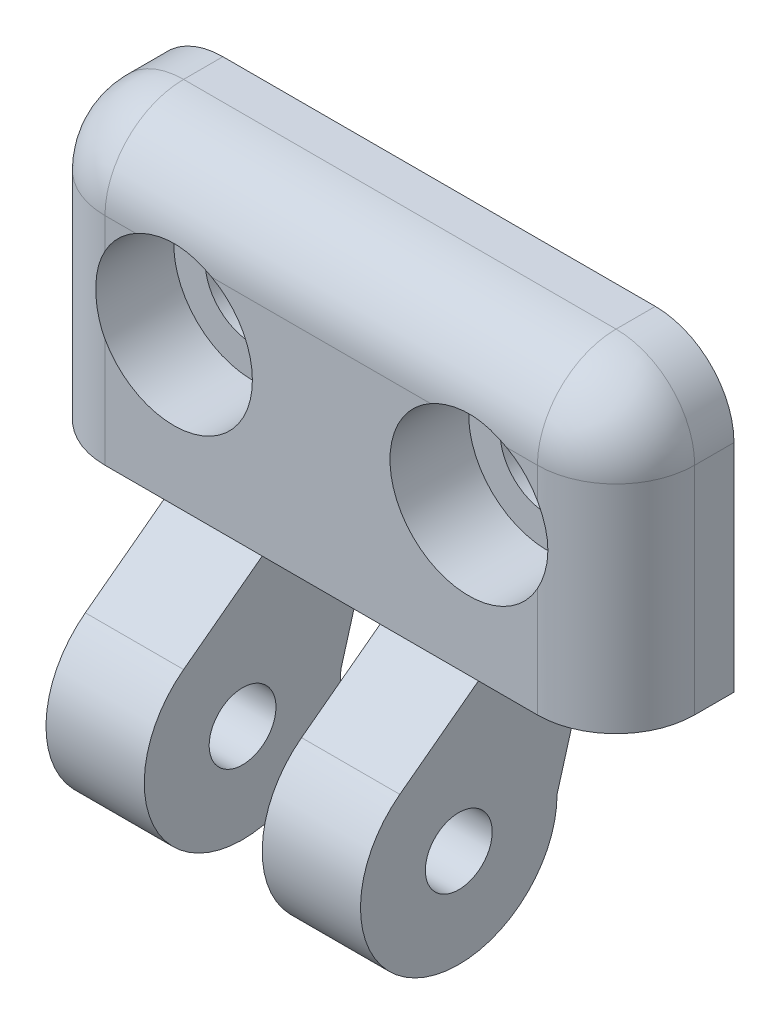
from build123d import *

# Parameters (mm, degrees)
SKETCH2_W                      = 30
SKETCH2_H                      = 15
BOSS_EXTRUDE1_DEPTH            = 6
CBORE_FOR_M4_SHCS1_D           = 4.8
CBORE_FOR_M4_SHCS1_CBORE_D     = 8
CBORE_FOR_M4_SHCS1_CBORE_DEPTH = 4
BOSS_EXTRUDE2_DEPTH            = 30
CUT_EXTRUDE1_START             = -15
SKETCH6_W                      = 6
SKETCH6_H                      = 18.030958188
SKETCH6_W_2                    = 16.282501636
SKETCH6_H_2                    = 17.921679654
SKETCH6_W_3                    = 7
SKETCH6_H_3                    = 20.435085946
CUT_EXTRUDE1_DEPTH             = 28.107006543
CUT_EXTRUDE2_DEPTH             = 30.966648128
CUT_EXTRUDE2_DEPTH_BACK        = 30.966648128
SKETCH7_R                      = 1.7
FILLET1_R                      = 4


with BuildPart() as part:
    # Sketch2 → Boss-Extrude1 (new body)
    with BuildSketch(Plane.XY):
        with Locations((15, 7.5)):
            Rectangle(SKETCH2_W, SKETCH2_H)
    extrude(amount=BOSS_EXTRUDE1_DEPTH)

    # CBORE for M4 SHCS1 (through all)
    with Locations(Plane.XY.offset(6)):
        with Locations((7.5, 7.5), (22.5, 7.5)):
            CounterBoreHole(CBORE_FOR_M4_SHCS1_D / 2, CBORE_FOR_M4_SHCS1_CBORE_D / 2, CBORE_FOR_M4_SHCS1_CBORE_DEPTH)

    # Sketch5 → Boss-Extrude2 (add)
    with BuildSketch(Plane(origin=(30, 0, 0), x_dir=(0, 0, -1), z_dir=(1, 0, 0))):
        with BuildLine():
            Line((0, 0), (-2, -7))
            ThreePointArc((-2, -7), (-9.236067977, -11.472135955), (-10, -3))
            Line((-10, -3), (-6, 0))
            Line((-6, 0), (0, 0))
        make_face()
    extrude(amount=-BOSS_EXTRUDE2_DEPTH)

    # Sketch6 → Cut-Extrude1 (cut, through all)
    with BuildSketch(Plane(origin=(0, 15, 0), x_dir=(1, 0, 0), z_dir=(0, 1, 0)).offset(CUT_EXTRUDE1_START)):
        with Locations((15, -4.71597722)):
            Rectangle(SKETCH6_W, SKETCH6_H)
        with Locations((-1.141250818, -5.644844763)):
            Rectangle(SKETCH6_W_2, SKETCH6_H_2)
        with Locations((26.5, -5.918041099)):
            Rectangle(SKETCH6_W_3, SKETCH6_H_3)
    extrude(amount=-CUT_EXTRUDE1_DEPTH, mode=Mode.SUBTRACT)

    # Sketch7 → Cut-Extrude2 (cut, two sides: drawn at the far end of the back side and taken through both)
    with BuildSketch(Plane.ZY.offset(-7).offset(-CUT_EXTRUDE2_DEPTH_BACK)):
        with Locations((7, -7)):
            Circle(SKETCH7_R)
    extrude(amount=CUT_EXTRUDE2_DEPTH + CUT_EXTRUDE2_DEPTH_BACK, mode=Mode.SUBTRACT)

    # Fillet1
    # the kernel refuses this fillet: 4 mm, written as the material it takes off along each edge
    with BuildSketch(Plane(origin=(26, 11, 2), x_dir=(0, 0, 1), z_dir=(1, 0, 0))) as fillet1_piece_1_section:
        Polygon((0, 0), (FILLET1_R, 0), (FILLET1_R, -FILLET1_R), (0, -FILLET1_R), align=None)
    fillet1_piece_1 = extrude(amount=FILLET1_R, mode=Mode.PRIVATE)
    fillet1_piece_1 = fillet1_piece_1 - Plane(origin=(26, 11, 2), x_dir=(0, -0.7071067811865475, -0.7071067811865475), z_dir=(1, 0, 0)) * Sphere(FILLET1_R, mode=Mode.PRIVATE)
    add(fillet1_piece_1, mode=Mode.SUBTRACT)
    with BuildSketch(Plane(origin=(4, 11, 2), x_dir=(0, 0, 1), z_dir=(-1, 0, 0))) as fillet1_piece_2_section:
        Polygon((0, 0), (FILLET1_R, 0), (FILLET1_R, FILLET1_R), (0, FILLET1_R), align=None)
    fillet1_piece_2 = extrude(amount=FILLET1_R, mode=Mode.PRIVATE)
    fillet1_piece_2 = fillet1_piece_2 - Plane(origin=(4, 11, 2), x_dir=(0, -0.7071067811865475, -0.7071067811865475), z_dir=(-1, 0, 0)) * Sphere(FILLET1_R, mode=Mode.PRIVATE)
    add(fillet1_piece_2, mode=Mode.SUBTRACT)
    with BuildSketch(Plane(origin=(30, -10, 6), x_dir=(-1, 0, 0), z_dir=(0, 1, 0))) as fillet1_piece_3:
        with BuildLine():
            CenterArc((FILLET1_R, -FILLET1_R), FILLET1_R, 90, 90)
            Line((0, -FILLET1_R), (0, 0))
            Line((0, 0), (FILLET1_R, 0))
        make_face()
    extrude(amount=21, mode=Mode.SUBTRACT)
    with BuildSketch(Plane(origin=(26, 15, 6), x_dir=(0, -1, 0), z_dir=(-1, 0, 0))) as fillet1_piece_4:
        with BuildLine():
            CenterArc((FILLET1_R, -FILLET1_R), FILLET1_R, 90, 90)
            Line((0, -FILLET1_R), (0, 0))
            Line((0, 0), (FILLET1_R, 0))
        make_face()
    extrude(amount=22, mode=Mode.SUBTRACT)
    with BuildSketch(Plane(origin=(0, 11, 6), x_dir=(0, 0, -1), z_dir=(0, -1, 0))) as fillet1_piece_5:
        with BuildLine():
            CenterArc((FILLET1_R, FILLET1_R), FILLET1_R, 180, 90)
            Line((0, FILLET1_R), (0, 0))
            Line((0, 0), (FILLET1_R, 0))
        make_face()
    extrude(amount=21, mode=Mode.SUBTRACT)
    with BuildSketch(Plane(origin=(0, 15, -10), x_dir=(0, -1, 0), z_dir=(0, 0, 1)), Plane(origin=(30, 15, -10), x_dir=(-1, 0, 0), z_dir=(0, 0, 1))) as fillet1_piece_6:
        with BuildLine():
            CenterArc((FILLET1_R, FILLET1_R), FILLET1_R, 180, 90)
            Line((0, FILLET1_R), (0, 0))
            Line((0, 0), (FILLET1_R, 0))
        make_face()
    extrude(amount=12, mode=Mode.SUBTRACT)


solid = part.part
